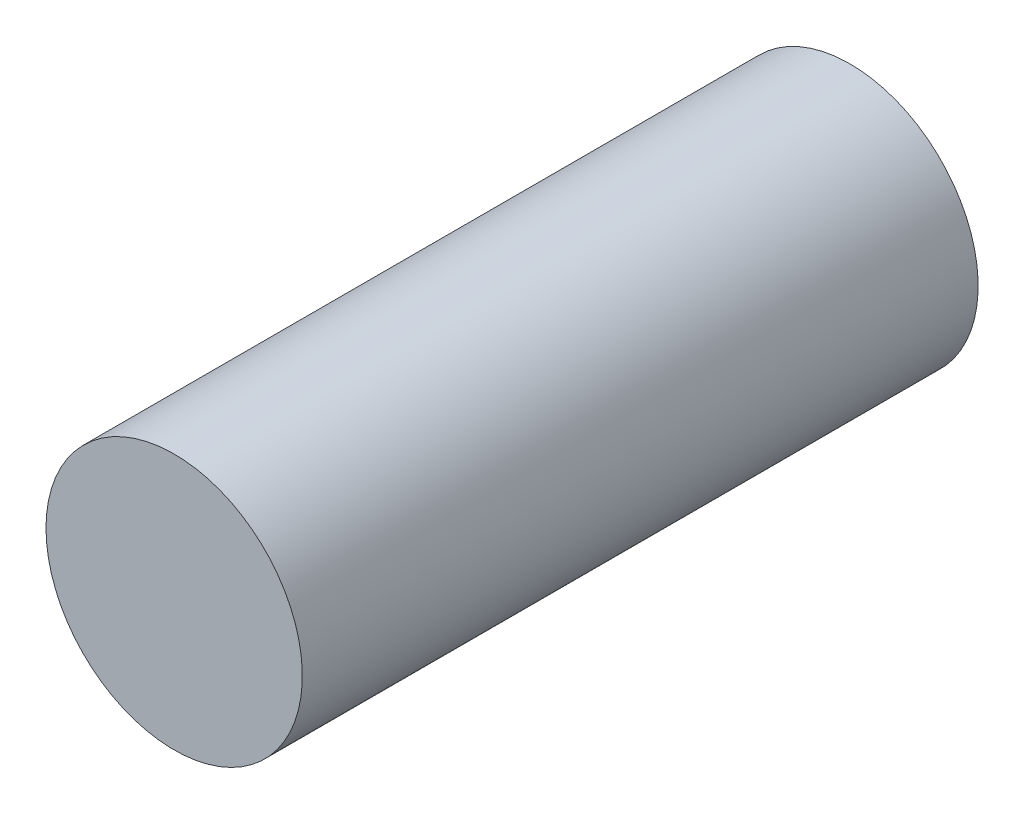
from build123d import *

# Parameters (mm, degrees)
SKETCH1_R           = 5.5
BOSS_EXTRUDE1_DEPTH = 29


with BuildPart() as part:
    # Sketch1 → Boss-Extrude1 (new body)
    with BuildSketch(Plane.XY):
        with Locations((-17.097066298, 11.961188675)):
            Circle(SKETCH1_R)
    extrude(amount=BOSS_EXTRUDE1_DEPTH)


solid = part.part
